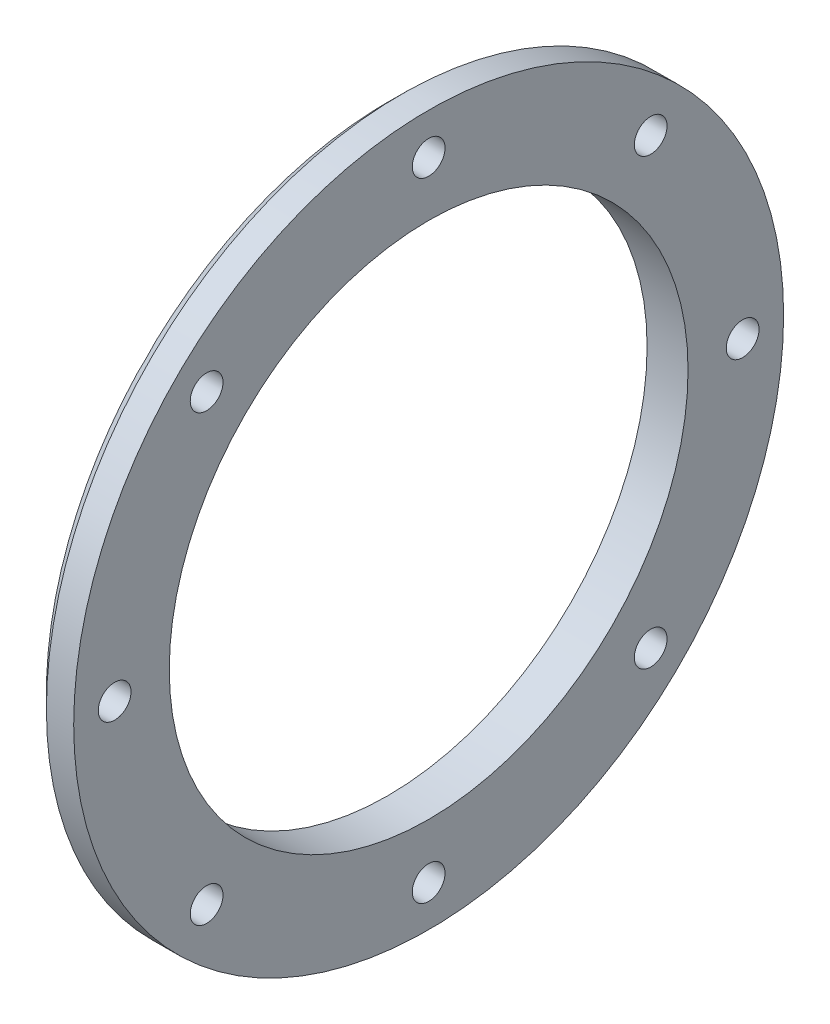
from build123d import *

# Parameters (mm, degrees)
HOLE_WIZARD_M21_D           = 2.4
HOLE_WIZARD_M21_CSINK_D     = 4.4
HOLE_WIZARD_M21_CSINK_ANGLE = 90
PATTERN_CIRCULAR_1_COUNT    = 8


with BuildPart() as part:
    # Эскиз1 → Повернуть1 (revolve)
    with BuildSketch(Plane.XY):
        Polygon((0, 19), (0, 25), (1, 26), (3, 26), (3, 19), align=None)
    revolve(axis=Axis((0, 0, 0), (1, 0, 0)))

    # Зенковка для винта с потайной головкой M21 (through all)
    with Locations(Plane.ZY):
        with Locations((16.263455967, 16.263455967)):
            hole_wizard_m21 = CounterSinkHole(HOLE_WIZARD_M21_D / 2, HOLE_WIZARD_M21_CSINK_D / 2, counter_sink_angle=HOLE_WIZARD_M21_CSINK_ANGLE)

    # Круговой массив1: Зенковка для винта с потайной головкой M21 ×8 about axis
    pattern_circular_1_axis = Axis((0, 0, 0), (-1, 0, 0))
    for i in range(1, PATTERN_CIRCULAR_1_COUNT):
        add(hole_wizard_m21.rotate(pattern_circular_1_axis, i * 360 / PATTERN_CIRCULAR_1_COUNT), mode=Mode.SUBTRACT)


solid = part.part
